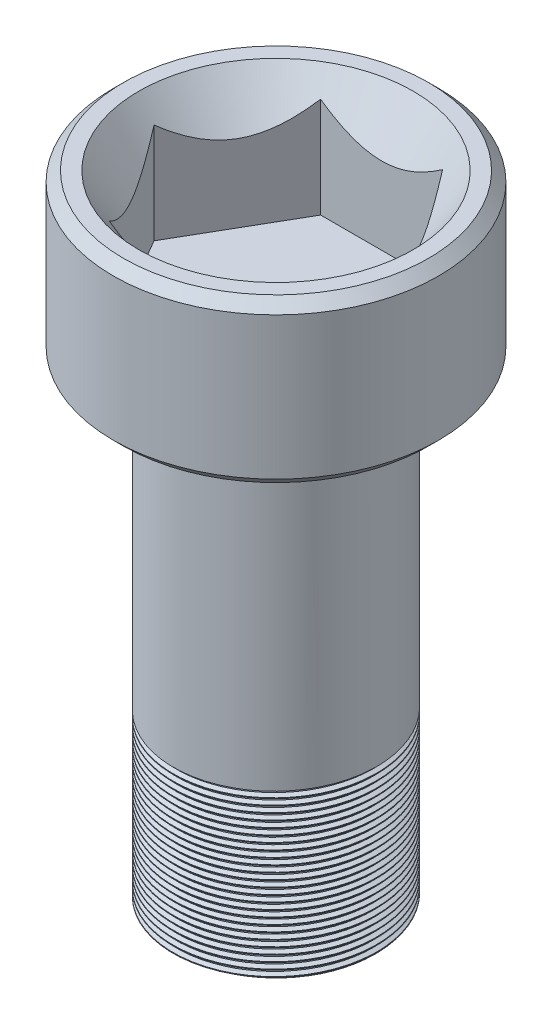
from build123d import *

# Parameters (mm, degrees)
SKETCH1_R           = 8
BOSS_EXTRUDE1_DEPTH = 11
SKETCH2_R           = 5
BOSS_EXTRUDE2_DEPTH = 25
CUT_EXTRUDE1_DEPTH  = 9
CHAMFER1_SIZE       = 0.5
CHAMFER2_SIZE       = 0.5
THREAD2_PITCH       = 0.3175
SKETCH59_R          = 7.5
CUT_EXTRUDE2_DEPTH  = 2
SKETCH60_R          = 15
CUT_EXTRUDE3_DEPTH  = 3
CHAMFER5_SIZE       = 0.5


with BuildPart() as part:
    # Sketch1 → Boss-Extrude1 (new body)
    with BuildSketch(Plane(origin=(0, 0, 0), x_dir=(1, 0, 0), z_dir=(0, 1, 0))):
        with Locations(Location((0, 0, 0), (0, 0, 270))):
            Circle(SKETCH1_R)
    extrude(amount=-BOSS_EXTRUDE1_DEPTH)

    # Sketch2 → Boss-Extrude2 (add)
    with BuildSketch(Plane.XZ.offset(11)):
        with Locations(Location((0, 0, 0), (0, 0, 270))):
            Circle(SKETCH2_R)
    extrude(amount=BOSS_EXTRUDE2_DEPTH)

    # Sketch3 → Cut-Extrude1 (cut)
    with BuildSketch(Plane(origin=(0, 0, 0), x_dir=(1, 0, 0), z_dir=(0, 1, 0))):
        Polygon((6, 0), (3, 5.196152423), (-3, 5.196152423), (-6, 0), (-3, -5.196152423), (3, -5.196152423), align=None)
    extrude(amount=-CUT_EXTRUDE1_DEPTH, mode=Mode.SUBTRACT)

    # Chamfer1
    chamfer1_edges = [part.edges().sort_by_distance(p)[0] for p in [
        (0, 0, -8),
    ]]
    chamfer(chamfer1_edges, length=CHAMFER1_SIZE)

    # Chamfer2
    chamfer2_edges = [part.edges().sort_by_distance(p)[0] for p in [
        (0, -11, -8),
    ]]
    chamfer(chamfer2_edges, length=CHAMFER2_SIZE)

    # Thread2: the profile of Thread Profile6 profile screwed along a right-hand helix of 31.496063 turns, 6 arcs to a turn; built about Z, then put on its axis
    thread2_z = Axis((0, 0, 0), (0, 0, 1))
    thread2_corners = [(5.0003, 0, -0.000173205), (5.0003, 0, 0.277985704), (4.828148085, 0, 0.17859375), (4.828148085, 0, 0.09921875)]
    with BuildLine(mode=Mode.PRIVATE) as thread2_profile:
        Line(thread2_corners[0], thread2_corners[1])
        Line(thread2_corners[1], thread2_corners[2])
        Line(thread2_corners[2], thread2_corners[3])
        Line(thread2_corners[3], thread2_corners[0])
    thread2_cap = Face(thread2_profile.wire())
    thread2_turn_angles = [0, 30, 60, 90, 120, 150, 180, 210, 240, 270, 300, 330, 360]
    thread2_turn_weights = [1, 0.8660254037844387, 1, 0.8660254037844387, 1, 0.8660254037844387, 1, 0.8660254037844387, 1, 0.8660254037844387, 1, 0.8660254037844387, 1]
    thread2_turn_rails = [Edge.make_bspline([Vector(p[0], p[1], 0).rotate(thread2_z, thread2_turn_angles[k]) / thread2_turn_weights[k] + Vector(0, 0, p[2] + THREAD2_PITCH * thread2_turn_angles[k] / 360) for k in range(13)], [0, 0, 0, 1, 1, 2, 2, 3, 3, 4, 4, 5, 5, 6, 6, 6], 2, thread2_turn_weights) for p in thread2_corners]
    thread2_turn_sides = [Face.make_surface_from_curves(thread2_turn_rails[p[0]], thread2_turn_rails[p[1]]) for p in [(0, 1), (1, 2), (2, 3), (3, 0)]]
    thread2_last_angles = [11160, 11190, 11220, 11250, 11280, 11309.291338583, 11338.582677165]
    thread2_last_weights = [1, 0.8660254037844387, 1, 0.8660254037844387, 1, 0.872143242535045, 1]
    thread2_last_rails = [Edge.make_bspline([Vector(p[0], p[1], 0).rotate(thread2_z, thread2_last_angles[k]) / thread2_last_weights[k] + Vector(0, 0, p[2] + THREAD2_PITCH * thread2_last_angles[k] / 360) for k in range(7)], [0, 0, 0, 1, 1, 2, 2, 3, 3, 3], 2, thread2_last_weights) for p in thread2_corners]
    thread2_last_sides = [Face.make_surface_from_curves(thread2_last_rails[p[0]], thread2_last_rails[p[1]]) for p in [(0, 1), (1, 2), (2, 3), (3, 0)]]
    thread2 = Plane(origin=(0, -36, 0), x_dir=(1, 0, 0), z_dir=(0, 1, 0)) * Solid(Shell([*[p.moved(Location((0, 0, THREAD2_PITCH * i))) for i in range(31) for p in thread2_turn_sides], *thread2_last_sides, thread2_cap, thread2_cap.rotate(thread2_z, 11338.582677165).moved(Location((0, 0, THREAD2_PITCH * 11338.582677165 / 360)))]))
    add(thread2, mode=Mode.SUBTRACT)

    # Sketch59 → Cut-Extrude2 (cut)
    with BuildSketch(Plane.XZ.offset(36)):
        Circle(SKETCH59_R)
    extrude(amount=-CUT_EXTRUDE2_DEPTH, mode=Mode.SUBTRACT)

    # Sketch60 → Cut-Extrude3 (cut)
    with BuildSketch(Plane(origin=(0, 0, 0), x_dir=(1, 0, 0), z_dir=(0, 1, 0))):
        Circle(SKETCH60_R)
    extrude(amount=-CUT_EXTRUDE3_DEPTH, mode=Mode.SUBTRACT)

    # Chamfer5
    chamfer5_edges = [part.edges().sort_by_distance(p)[0] for p in [
        (0, -3, -8),
    ]]
    chamfer(chamfer5_edges, length=CHAMFER5_SIZE)

    # Sketch61 → Cut-Revolve1 (revolve, cut)
    with BuildSketch(Plane.XY, mode=Mode.PRIVATE) as cut_revolve1_sk:
        Polygon((-6.957580903, -2.715225479), (-4.205238023, -6.590973616), (-4.205238023, -2.715225479), align=None)
    revolve(cut_revolve1_sk.sketch.rotate(Axis((0, 0, 0), (0, 1, 0)), 358.58267124), axis=Axis((0, 0, 0), (0, 1, 0)), mode=Mode.SUBTRACT)


solid = part.part
